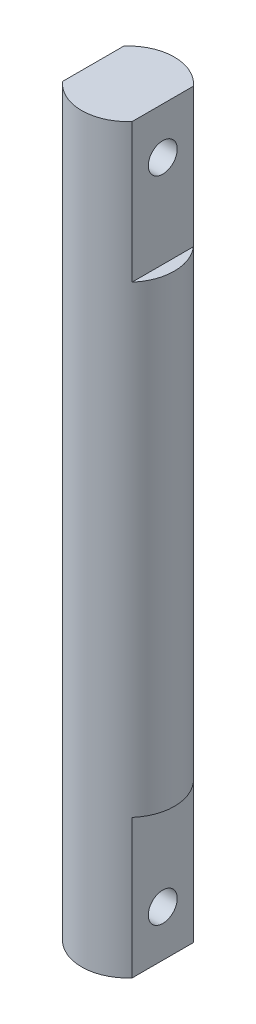
from build123d import *

# Parameters (mm, degrees)
EXTRUDE_1_DEPTH              = 32
EXTRUDE_1_DEPTH_BACK         = 32
SKETCH_1_R                   = 4
HOLE_WIZARD_M3_2_D           = 2.5
HOLE_WIZARD_M3_2_CSINK_D     = 3.05
HOLE_WIZARD_M3_2_CSINK_ANGLE = 90
SKETCH_18_W                  = 33.250745193
SKETCH_18_H                  = 19.055234746
SKETCH_18_W_2                = 46.103437085
SKETCH_18_H_2                = 35.552719861
CUT_EXTRUDE_1_DEPTH          = 7
CUT_EXTRUDE_2_DEPTH          = 12
CUT_EXTRUDE_START            = -12
CUT_EXTRUDE_3_DEPTH          = 12


with BuildPart() as part:
    # 草图1 → 凸台-拉伸1 (new, two sides: drawn at the far end of the back side and taken through both)
    with BuildSketch(Plane(origin=(0, 0, 0), x_dir=(1, 0, 0), z_dir=(0, 1, 0)).offset(-EXTRUDE_1_DEPTH_BACK)):
        Circle(SKETCH_1_R)
    extrude(amount=EXTRUDE_1_DEPTH + EXTRUDE_1_DEPTH_BACK)

    # M3 螺纹孔2 (through all)
    with Locations(Plane(origin=(10, 0, 0), x_dir=(0, 0, -1), z_dir=(1, 0, 0))):
        with Locations((0, 28), (0, -28)):
            CounterSinkHole(HOLE_WIZARD_M3_2_D / 2, HOLE_WIZARD_M3_2_CSINK_D / 2, counter_sink_angle=HOLE_WIZARD_M3_2_CSINK_ANGLE)

    # 草图18 → 切除-拉伸1 (cut)
    with BuildSketch(Plane(origin=(10, 0, 0), x_dir=(0, 0, -1), z_dir=(1, 0, 0))):
        with Locations((-0.619455311, 29.527617373)):
            Rectangle(SKETCH_18_W, SKETCH_18_H)
        with Locations((-0.267764737, -37.77635993)):
            Rectangle(SKETCH_18_W_2, SKETCH_18_H_2)
    extrude(amount=-CUT_EXTRUDE_1_DEPTH, mode=Mode.SUBTRACT)

    # 草图19 → 切除-拉伸2 (cut)
    with BuildSketch(Plane.XZ.offset(32)):
        with BuildLine():
            Line((3, -2.645751311), (3, 2.645751311))
            ThreePointArc((3, 2.645751311), (4, 0), (3, -2.645751311))
        make_face()
        with BuildLine():
            Line((-3, -2.645751311), (-3, 2.645751311))
            ThreePointArc((-3, 2.645751311), (-4, 0), (-3, -2.645751311))
        make_face()
    extrude(amount=-CUT_EXTRUDE_2_DEPTH, mode=Mode.SUBTRACT)

    # 草图20 → 切除-拉伸3 (cut)
    with BuildSketch(Plane(origin=(0, 32, 0), x_dir=(1, 0, 0), z_dir=(0, 1, 0)).offset(CUT_EXTRUDE_START)):
        with BuildLine():
            Line((3, -2.645751311), (3, 2.645751311))
            ThreePointArc((3, 2.645751311), (4, 0), (3, -2.645751311))
        make_face()
        with BuildLine():
            Line((-3, -2.645751311), (-3, 2.645751311))
            ThreePointArc((-3, 2.645751311), (-4, 0), (-3, -2.645751311))
        make_face()
    extrude(amount=CUT_EXTRUDE_3_DEPTH, mode=Mode.SUBTRACT)


solid = part.part
